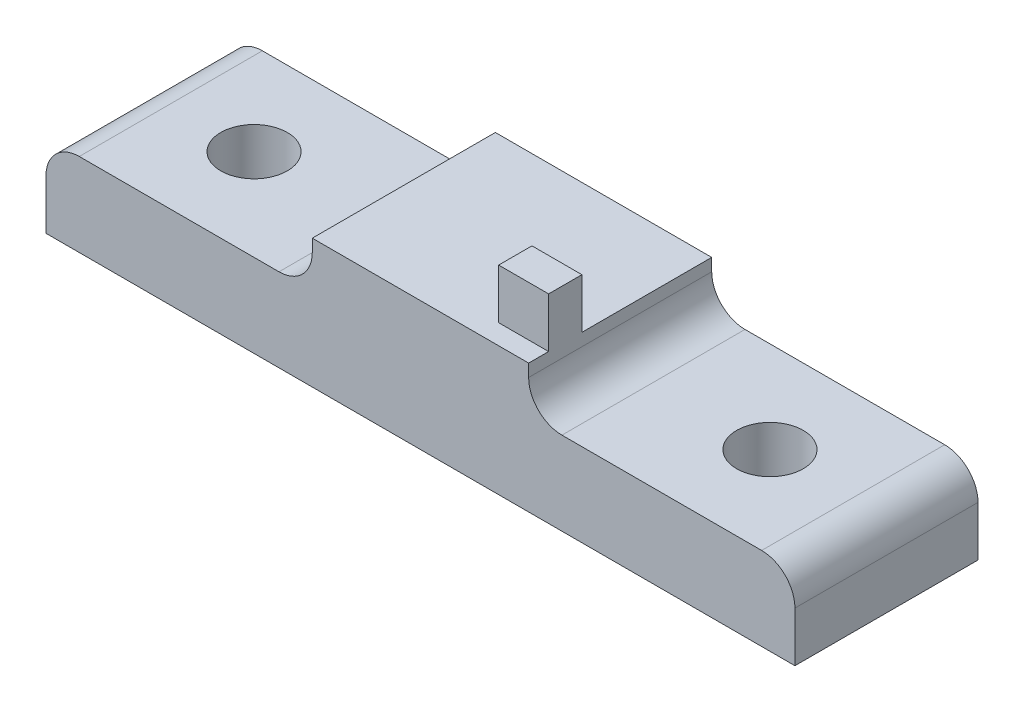
from build123d import *

# Parameters (mm, degrees)
BOSS_EXTRUDE1_DEPTH      = 2
SKETCH2_R                = 1
CUT_EXTRUDE1_DEPTH       = 11.827309223
CUT_EXTRUDE2_DEPTH       = 11.827309223
BOSS_EXTRUDE3_DEPTH      = 15
BOSS_EXTRUDE3_DEPTH_BACK = 2
SKETCH4_W                = 13
SKETCH4_H                = 4.75
SKETCH6_W                = 11
SKETCH6_H                = 2
BOSS_EXTRUDE4_DEPTH      = 16
SKETCH7_W                = 11
SKETCH7_H                = 2
BOSS_EXTRUDE5_DEPTH      = 16
SKETCH8_R                = 2
CUT_EXTRUDE3_DEPTH       = 31.850810362
FILLET5_R                = 2
FILLET6_R                = 2
FILLET7_R                = 2
FILLET8_R                = 2
SKETCH10_W               = 2
SKETCH10_H               = 16.939290608
CUT_EXTRUDE4_DEPTH       = 34.719143302
SKETCH11_W               = 13
SKETCH11_H               = 6
CUT_EXTRUDE5_DEPTH       = 28.45564605
SKETCH12_W               = 3
SKETCH12_H               = 2
BOSS_EXTRUDE6_DEPTH      = 3
SKETCH13_W               = 45
SKETCH13_H               = 11
SKETCH13_R               = 2
BOSS_EXTRUDE7_DEPTH      = 3


with BuildPart() as part:
    # Sketch1 → Boss-Extrude1 (new body)
    with BuildSketch(Plane.XY):
        with BuildLine():
            Line((-5.5, -8.425), (5.5, -8.425))
            ThreePointArc((5.5, -8.425), (6.207106781, -8.132106781), (6.5, -7.425))
            Line((6.5, -7.425), (6.5, 7.425))
            ThreePointArc((6.5, 7.425), (6.207106781, 8.132106781), (5.5, 8.425))
            Line((5.5, 8.425), (-5.5, 8.425))
            ThreePointArc((-5.5, 8.425), (-6.207106781, 8.132106781), (-6.5, 7.425))
            Line((-6.5, 7.425), (-6.5, -7.425))
            ThreePointArc((-6.5, -7.425), (-6.207106781, -8.132106781), (-5.5, -8.425))
        make_face()
    extrude(amount=BOSS_EXTRUDE1_DEPTH)

    # Sketch2 → Cut-Extrude1 (cut, through all)
    with BuildSketch(Plane.XY.offset(2)):
        with Locations((0, 6.75)):
            Circle(SKETCH2_R)
        with Locations((0, -2)):
            Circle(SKETCH2_R)
    extrude(amount=-CUT_EXTRUDE1_DEPTH, mode=Mode.SUBTRACT)

    # Sketch3 → Cut-Extrude2 (cut, through all)
    with BuildSketch(Plane.XY.offset(2)):
        with BuildLine():
            Line((1.8, 2.875), (1.8, 1.875))
            ThreePointArc((1.8, 1.875), (0, 0.075), (-1.8, 1.875))
            Line((-1.8, 1.875), (-1.8, 2.875))
            ThreePointArc((-1.8, 2.875), (0, 4.675), (1.8, 2.875))
        make_face()
    extrude(amount=-CUT_EXTRUDE2_DEPTH, mode=Mode.SUBTRACT)

    # Sketch4 → Boss-Extrude3 (add, two sides: drawn at the far end of the back side and taken through both)
    with BuildSketch(Plane(origin=(0, 0, 0), x_dir=(-1, 0, 0), z_dir=(0, 0, -1)).offset(-BOSS_EXTRUDE3_DEPTH_BACK)):
        with Locations((0, -6.05)):
            Rectangle(SKETCH4_W, SKETCH4_H)
    extrude(amount=BOSS_EXTRUDE3_DEPTH + BOSS_EXTRUDE3_DEPTH_BACK)

    # Sketch6 → Boss-Extrude4 (add)
    with BuildSketch(Plane(origin=(6.5, 0, 0), x_dir=(0, 0, -1), z_dir=(1, 0, 0))):
        with Locations((9.5, -7.425)):
            Rectangle(SKETCH6_W, SKETCH6_H)
    extrude(amount=BOSS_EXTRUDE4_DEPTH)

    # Sketch7 → Boss-Extrude5 (add)
    with BuildSketch(Plane.ZY.offset(6.5)):
        with Locations((-9.5, -7.425)):
            Rectangle(SKETCH7_W, SKETCH7_H)
    extrude(amount=BOSS_EXTRUDE5_DEPTH)

    # Sketch8 → Cut-Extrude3 (cut, through all)
    with BuildSketch(Plane(origin=(0, -6.425, 0), x_dir=(1, 0, 0), z_dir=(0, 1, 0))):
        with Locations(Location((15.5, 9.5, 0), (0, 0, 270))):
            Circle(SKETCH8_R)
        with Locations(Location((-15.5, 9.5, 0), (0, 0, 270))):
            Circle(SKETCH8_R)
    extrude(amount=-CUT_EXTRUDE3_DEPTH, mode=Mode.SUBTRACT)

    # Fillet5
    fillet5_edges = [part.edges().sort_by_distance(p)[0] for p in [
        (22.5, -6.425, -9.5),
    ]]
    fillet(fillet5_edges, radius=FILLET5_R - 0.0001)  # a hair under: the kernel refuses the full size

    # Fillet6
    fillet6_edges = [part.edges().sort_by_distance(p)[0] for p in [
        (-22.5, -6.425, -9.5),
    ]]
    fillet(fillet6_edges, radius=FILLET6_R - 0.0001)  # a hair under: the kernel refuses the full size

    # Fillet7
    fillet7_edges = [part.edges().sort_by_distance(p)[0] for p in [
        (6.5, -6.425, -9.5),
    ]]
    fillet(fillet7_edges, radius=FILLET7_R)

    # Fillet8
    fillet8_edges = [part.edges().sort_by_distance(p)[0] for p in [
        (-6.5, -6.425, -9.5),
    ]]
    fillet(fillet8_edges, radius=FILLET8_R)

    # Sketch10 → Cut-Extrude4 (cut, through all)
    with BuildSketch(Plane(origin=(6.5, 0, 0), x_dir=(0, 0, -1), z_dir=(1, 0, 0))):
        with Locations((-1, 4.794645304)):
            Rectangle(SKETCH10_W, SKETCH10_H)
    extrude(amount=-CUT_EXTRUDE4_DEPTH, mode=Mode.SUBTRACT)

    # Sketch11 → Cut-Extrude5 (cut, through all)
    with BuildSketch(Plane(origin=(0, -3.675, 0), x_dir=(1, 0, 0), z_dir=(0, 1, 0))):
        with Locations((0, 1)):
            Rectangle(SKETCH11_W, SKETCH11_H)
    extrude(amount=-CUT_EXTRUDE5_DEPTH, mode=Mode.SUBTRACT)

    # Sketch12 → Boss-Extrude6 (add)
    with BuildSketch(Plane(origin=(0, -3.675, 0), x_dir=(1, 0, 0), z_dir=(0, 1, 0))):
        with Locations((5, 6.2)):
            Rectangle(SKETCH12_W, SKETCH12_H)
    extrude(amount=BOSS_EXTRUDE6_DEPTH)

    # Sketch13 → Boss-Extrude7 (add)
    with BuildSketch(Plane.XZ.offset(8.425)):
        with Locations((0, -9.5)):
            Rectangle(SKETCH13_W, SKETCH13_H)
        with Locations(Location((-15.5, -9.5, 0), (0, 0, 90))):
            Circle(SKETCH13_R, mode=Mode.SUBTRACT)
        with Locations(Location((15.5, -9.5, 0), (0, 0, 90))):
            Circle(SKETCH13_R, mode=Mode.SUBTRACT)
    extrude(amount=BOSS_EXTRUDE7_DEPTH)


solid = part.part
